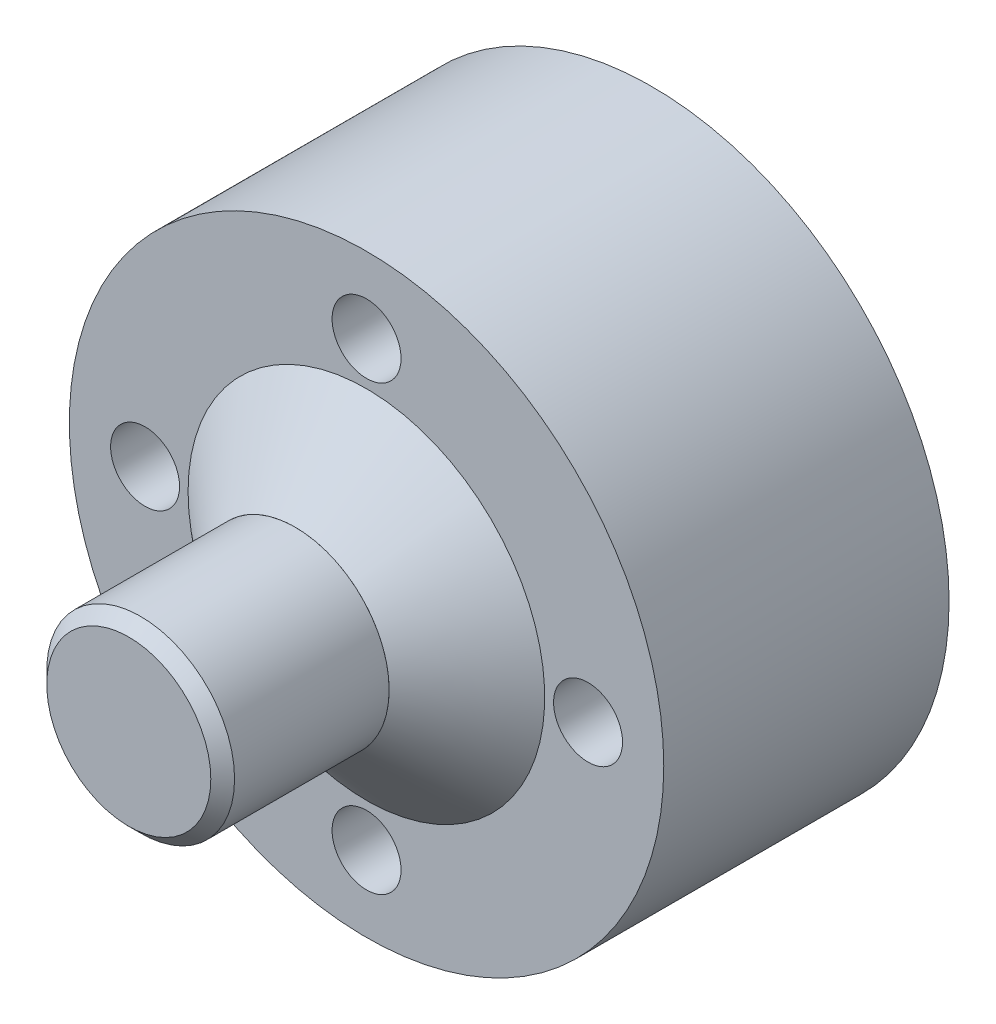
from build123d import *

# Parameters (mm, degrees)
SKETCH1_R           = 12.5
BOSS_EXTRUDE1_DEPTH = 3.5
CUT_EXTRUDE1_REACH  = 21.013
SKETCH8_W           = 12.25
SKETCH8_H           = 12.25
SKETCH11_R          = 1.45
CUT_EXTRUDE4_DEPTH  = 20.013153342
BOSS_EXTRUDE2_START = 5
SKETCH14_R          = 12.5
BOSS_EXTRUDE2_DEPTH = 5
SKETCH15_R          = 3.95
BOSS_EXTRUDE3_DEPTH = 7
CHAMFER1_SIZE       = 0.5
SKETCH18_R          = 1.45
CUT_EXTRUDE6_DEPTH  = 30


with BuildPart() as part:
    # Sketch1 → Boss-Extrude1 (new, symmetric)
    with BuildSketch(Plane.XY):
        Circle(SKETCH1_R)
    extrude(amount=BOSS_EXTRUDE1_DEPTH, both=True)

    # Sketch8 → Cut-Extrude1 (cut, up to next)
    with BuildSketch(Plane.XY.offset(3.5), mode=Mode.PRIVATE) as cut_extrude1_sk1:
        Rectangle(SKETCH8_W, SKETCH8_H)
    cut_extrude1_tool1 = extrude(cut_extrude1_sk1.sketch, amount=-CUT_EXTRUDE1_REACH, mode=Mode.PRIVATE) & part.part
    add(cut_extrude1_tool1.solids().sort_by_distance((0, 0, 3.5))[0], mode=Mode.SUBTRACT)

    # Sketch11 → Cut-Extrude4 (cut, through all)
    with BuildSketch(Plane.XY.offset(3.5)):
        with Locations((9.315, 0)):
            Circle(SKETCH11_R)
        with Locations((0, -9.315)):
            Circle(SKETCH11_R)
        with Locations((-9.315, 0)):
            Circle(SKETCH11_R)
        with Locations((0, 9.315)):
            Circle(SKETCH11_R)
    extrude(amount=-CUT_EXTRUDE4_DEPTH, mode=Mode.SUBTRACT)

    # Sketch14 → Boss-Extrude2 (add)
    with BuildSketch(Plane.XY.offset(3.5).offset(BOSS_EXTRUDE2_START)):
        Circle(SKETCH14_R)
    extrude(amount=-BOSS_EXTRUDE2_DEPTH)

    # Sketch18 → Cut-Extrude6 (cut)
    with BuildSketch(Plane.XY.offset(8.5)):
        with Locations((-9.315, 0)):
            Circle(SKETCH18_R)
        with Locations((0, -9.315)):
            Circle(SKETCH18_R)
        with Locations((9.315, 0)):
            Circle(SKETCH18_R)
        with Locations((0, 9.315)):
            Circle(SKETCH18_R)
    extrude(amount=-CUT_EXTRUDE6_DEPTH, mode=Mode.SUBTRACT)


with BuildPart() as body_2:
    # Sketch13 → Revolve1 (revolve)
    with BuildSketch(Plane(origin=(0, 0, 0), x_dir=(1, 0, 0), z_dir=(0, 1, 0))):
        Polygon((0, -11.5), (3.95, -11.5), (7.5, -8.506732209), (0, -8.506732209), align=None)
    revolve(axis=Axis((0, 0, 11.965062333), (0, 0, 1)))


with BuildPart() as body_3:
    # Sketch15 → Boss-Extrude3 (new body)
    with BuildSketch(Plane.XY.offset(11.5)):
        Circle(SKETCH15_R)
    extrude(amount=BOSS_EXTRUDE3_DEPTH)

    # Chamfer1
    chamfer1_edges = [body_3.edges().sort_by_distance(p)[0] for p in [
        (-3.95, 0, 18.5),
    ]]
    chamfer(chamfer1_edges, length=CHAMFER1_SIZE)


solid = Compound([part.part, body_2.part, body_3.part])
